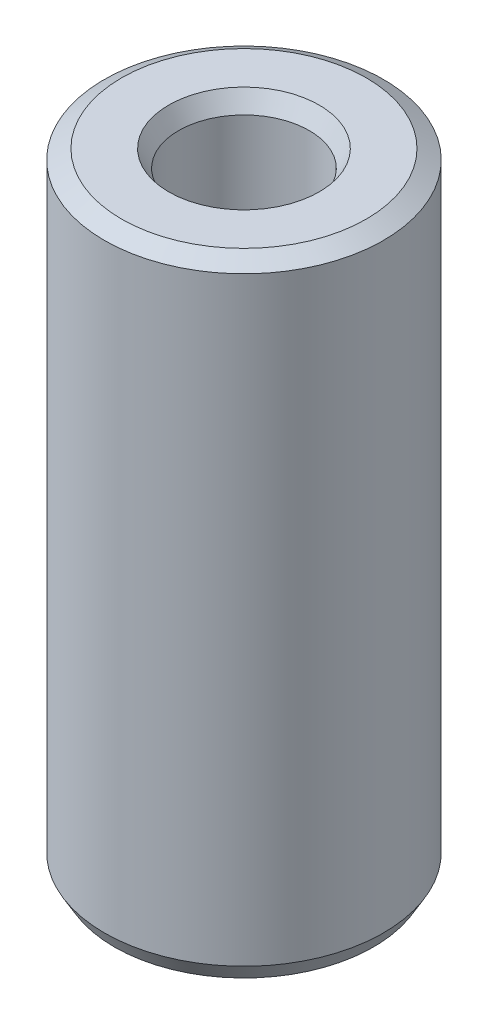
from build123d import *
from OCP.BRepFilletAPI import BRepFilletAPI_MakeChamfer

# Parameters (mm, degrees)
SKETCH1_R           = 35
BOSS_EXTRUDE1_DEPTH = 157.239863962
SKETCH2_R           = 16.394586179
CUT_EXTRUDE1_DEPTH  = 165.846518977
CHAMFER1_SIZE       = 2.48354559
CHAMFER1_SIZE2      = 4.301627144


with BuildPart() as part:
    # Sketch1 → Boss-Extrude1 (new body)
    with BuildSketch(Plane(origin=(0, 0, 0), x_dir=(1, 0, 0), z_dir=(0, 1, 0))):
        Circle(SKETCH1_R)
    extrude(amount=BOSS_EXTRUDE1_DEPTH)

    # Sketch2 → Cut-Extrude1 (cut, through all)
    with BuildSketch(Plane(origin=(0, 0, 0), x_dir=(1, 0, 0), z_dir=(0, 1, 0))):
        Circle(SKETCH2_R)
    extrude(amount=CUT_EXTRUDE1_DEPTH, mode=Mode.SUBTRACT)

    # Chamfer1: one chamfer whose edges measure the first distance from different faces: ONE call of the kernel's chamfer builder (chamfer() names one face for all edges)
    chamfer1_edges_1 = [part.edges().sort_by_distance(p)[0] for p in [
        (-16.394586179, 157.239863962, 0),
    ]]
    chamfer1_side_1 = [part.faces().sort_by_distance(p)[0] for p in [
        (-34.010050506, 157.239863962, 0),
    ]]
    chamfer1_edges_2 = [part.edges().sort_by_distance(p)[0] for p in [
        (-16.394586179, 0, 0),
    ]]
    chamfer1_side_2 = [part.faces().sort_by_distance(p)[0] for p in [
        (-16.394586179, 78.619931981, 0),
    ]]
    chamfer1_edges_3 = [part.edges().sort_by_distance(p)[0] for p in [
        (-35, 0, 0),
    ]]
    chamfer1_side_3 = [part.faces().sort_by_distance(p)[0] for p in [
        (-34.010050506, 0, 0),
    ]]
    chamfer1_edges_4 = [part.edges().sort_by_distance(p)[0] for p in [
        (-35, 157.239863962, 0),
    ]]
    chamfer1_side_4 = [part.faces().sort_by_distance(p)[0] for p in [
        (-35, 78.619931981, 0),
    ]]
    chamfer1 = BRepFilletAPI_MakeChamfer(part.part.solid().wrapped)
    for e in chamfer1_edges_1:
        chamfer1.Add(CHAMFER1_SIZE, CHAMFER1_SIZE2, e.wrapped, chamfer1_side_1[0].wrapped)  # the first distance lies on this face
    for e in chamfer1_edges_2:
        chamfer1.Add(CHAMFER1_SIZE, CHAMFER1_SIZE2, e.wrapped, chamfer1_side_2[0].wrapped)  # the first distance lies on this face
    for e in chamfer1_edges_3:
        chamfer1.Add(CHAMFER1_SIZE, CHAMFER1_SIZE2, e.wrapped, chamfer1_side_3[0].wrapped)  # the first distance lies on this face
    for e in chamfer1_edges_4:
        chamfer1.Add(CHAMFER1_SIZE, CHAMFER1_SIZE2, e.wrapped, chamfer1_side_4[0].wrapped)  # the first distance lies on this face
    add(Compound.cast(chamfer1.Shape()), mode=Mode.REPLACE)


solid = part.part
